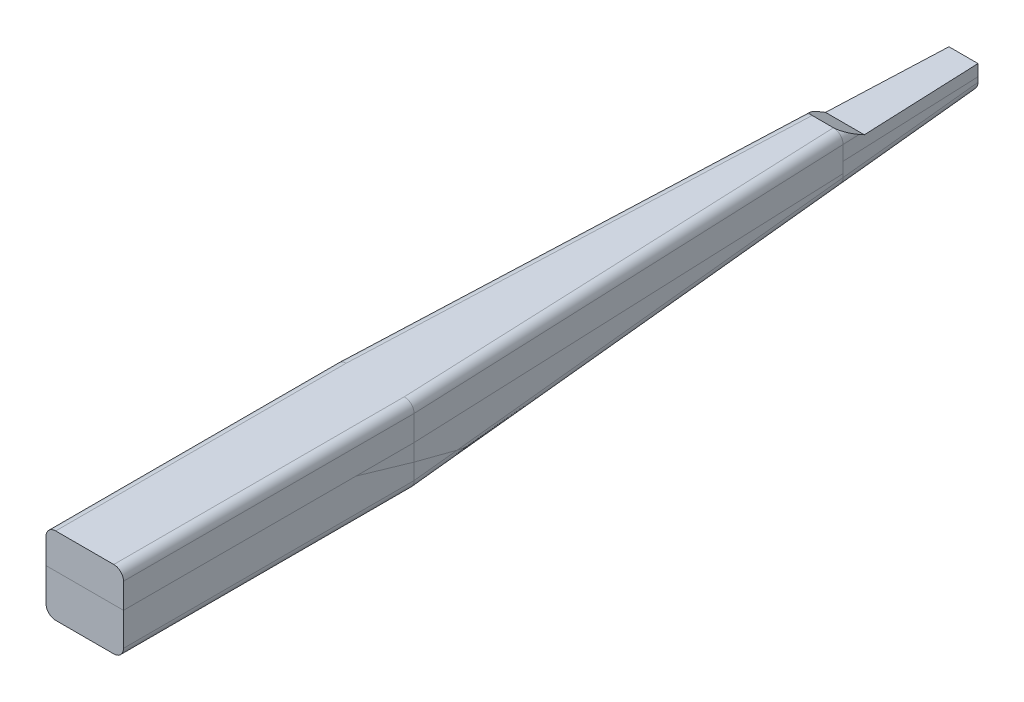
from build123d import *

# Parameters (mm, degrees)
SKETCH1_W              = 101.6
SKETCH1_H              = 101.6
BOSS_EXTRUDE1_DEPTH    = 381.1016
FILLET1_R              = 12.7
CUT_EXTRUDE2_DEPTH     = 177.8508
SPLIT1_SURFACE_1_BACK  = 1162.17
SPLIT1_SURFACE_1_DEPTH = 2324.34
SPLIT1_SURFACE_2_BACK  = 1162.17
SPLIT1_SURFACE_2_DEPTH = 2324.34


with BuildPart() as part:
    # Sketch1 → Boss-Extrude1 (new body)
    with BuildSketch(Plane.XY):
        Rectangle(SKETCH1_W, SKETCH1_H)
    extrude(amount=-BOSS_EXTRUDE1_DEPTH)

    # Sketch2 → section 0 of loft1
    with BuildSketch(Plane(origin=(0, 0, -1152.2456), x_dir=(-1, 0, 0), z_dir=(0, 0, -1)), mode=Mode.PRIVATE) as loft1_s0:
        with BuildLine():
            Line((-19.05, 50.8), (19.05, 50.8))
            Line((19.05, 50.8), (19.05, 0))
            Line((19.05, 0), (-19.05, 0))
            Line((-19.05, 0), (-19.05, 50.8))
        make_face()
    # loft up to a face of the part (loft1)
    loft([loft1_s0.sketch, part.faces().sort_by_distance((0, 0, -381.1016))[0]])

    # Fillet1
    # the kernel refuses this fillet: 12.7 mm, written as the material it takes off along each edge
    with BuildSketch(Plane(origin=(-50.8, -50.8, 31.75), x_dir=(1, 0, 0), z_dir=(0, 0, -1)), Plane(origin=(-50.8, 50.8, 31.75), x_dir=(0, -1, 0), z_dir=(0, 0, -1))) as fillet1_piece_1:
        with BuildLine():
            CenterArc((FILLET1_R, -FILLET1_R), FILLET1_R, 90, 90)
            Line((0, -FILLET1_R), (0, 0))
            Line((0, 0), (FILLET1_R, 0))
        make_face()
    extrude(amount=444.6016, mode=Mode.SUBTRACT)
    with BuildSketch(Plane(origin=(50.8, 50.8, 31.75), x_dir=(0, -1, 0), z_dir=(0, 0, -1)), Plane(origin=(50.8, -50.8, 31.75), x_dir=(-1, 0, 0), z_dir=(0, 0, -1))) as fillet1_piece_2:
        with BuildLine():
            CenterArc((FILLET1_R, FILLET1_R), FILLET1_R, 180, 90)
            Line((0, FILLET1_R), (0, 0))
            Line((0, 0), (FILLET1_R, 0))
        make_face()
    extrude(amount=444.6016, mode=Mode.SUBTRACT)
    with BuildSketch(Plane(origin=(17.750216352, 2.079653836, -1183.814745237), x_dir=(-0.999157137883709, -0.002698296397467829, 0.0409601393135606), z_dir=(0.04104891979132801, -0.06567827166612486, 0.9969961638917754))) as fillet1_piece_3:
        with BuildLine():
            CenterArc((FILLET1_R * 0.997299511279, -FILLET1_R), FILLET1_R, 90, 89.845064287)
            Line((-FILLET1_R * 0.00269683254081, -FILLET1_R * 0.997295864973), (0, 0))
            Line((0, 0), (FILLET1_R * 0.997299511279, 0))
        make_face()
    extrude(amount=836.795888178, mode=Mode.SUBTRACT)
    with BuildSketch(Plane(origin=(-17.750216352, 2.079653836, -1183.814745237), x_dir=(0.999157137883709, -0.0026982963974682855, 0.040960139313560615), z_dir=(-0.041048919791328055, -0.06567827166612487, 0.9969961638917754))) as fillet1_piece_4:
        with BuildLine():
            CenterArc((FILLET1_R * 0.997299511279, FILLET1_R), FILLET1_R, 180.154935713, 89.845064287)
            Line((-FILLET1_R * 0.00269683254081, FILLET1_R * 0.997295864973), (0, 0))
            Line((0, 0), (FILLET1_R * 0.997299511279, 0))
        make_face()
    extrude(amount=836.795888178, mode=Mode.SUBTRACT)
    with BuildSketch(Plane(origin=(-17.743876682, 50.8, -1183.968723142), x_dir=(0.9991534847855587, 0, 0.041137742291895554), z_dir=(-0.041137742291895554, 0, 0.9991534847855587))) as fillet1_piece_5:
        with BuildLine():
            CenterArc((FILLET1_R, -FILLET1_R), FILLET1_R, 90, 90)
            Line((0, -FILLET1_R), (0, 0))
            Line((0, 0), (FILLET1_R, 0))
        make_face()
    extrude(amount=835.297338189, mode=Mode.SUBTRACT)
    with BuildSketch(Plane(origin=(17.743876682, 50.8, -1183.968723142), x_dir=(-0.9991534847855587, 0, 0.041137742291895485), z_dir=(0.04113774229189549, 0, 0.9991534847855587))) as fillet1_piece_6:
        with BuildLine():
            CenterArc((FILLET1_R, FILLET1_R), FILLET1_R, 180, 90)
            Line((0, FILLET1_R), (0, 0))
            Line((0, 0), (FILLET1_R, 0))
        make_face()
    extrude(amount=835.297338189, mode=Mode.SUBTRACT)

    # Sketch4 → Cut-Extrude2 (cut, symmetric)
    with BuildSketch(Plane(origin=(0, 0, 0), x_dir=(0, 0, -1), z_dir=(1, 0, 0))):
        Polygon((1152.2456, 50.8), (1152.2456, 34.036), (996.7976, 34.036), (967.761500262, 50.8), align=None)
    extrude(amount=CUT_EXTRUDE2_DEPTH, both=True, mode=Mode.SUBTRACT)


with BuildPart() as body_2:
    # Split1: the piece behind the surface
    add(part.part)
    # Split1 surface: a surface, the sketch's curves swept straight by 2324.34 mm
    with BuildLine(Plane(origin=(50.8, 0, 0), x_dir=(0, 0, -1), z_dir=(1, 0, 0)).offset(-SPLIT1_SURFACE_1_BACK), mode=Mode.PRIVATE) as split1_surface_1_path:
        Line((0, -50.8), (0, 5.08))
        Line((0, 5.08), (304.8, 5.08))
        Line((304.8, 5.08), (475.411000163, -44.587259541))
        Line((475.411000163, -44.587259541), (381.1016, -50.8))
        Line((381.1016, -50.8), (0, -50.8))
    split1_surface_1 = Shell.extrude(split1_surface_1_path.wire(), (1 * SPLIT1_SURFACE_1_DEPTH, 0 * SPLIT1_SURFACE_1_DEPTH, 0 * SPLIT1_SURFACE_1_DEPTH))
    split(bisect_by=split1_surface_1, keep=Keep.BOTTOM)


with BuildPart() as part_1:
    add(part.part)

    # Split1: split by a surface, the side it looks to stays
    # Split1 surface: a surface, the sketch's curves swept straight by 2324.34 mm
    with BuildLine(Plane(origin=(50.8, 0, 0), x_dir=(0, 0, -1), z_dir=(1, 0, 0)).offset(-SPLIT1_SURFACE_2_BACK), mode=Mode.PRIVATE) as split1_surface_2_path:
        Line((0, -50.8), (0, 5.08))
        Line((0, 5.08), (304.8, 5.08))
        Line((304.8, 5.08), (475.411000163, -44.587259541))
        Line((475.411000163, -44.587259541), (381.1016, -50.8))
        Line((381.1016, -50.8), (0, -50.8))
    split1_surface_2 = Shell.extrude(split1_surface_2_path.wire(), (1 * SPLIT1_SURFACE_2_DEPTH, 0 * SPLIT1_SURFACE_2_DEPTH, 0 * SPLIT1_SURFACE_2_DEPTH))
    split(bisect_by=split1_surface_2, keep=Keep.TOP)


with BuildPart() as body_3:
    # Split3: the piece on the far side of the plane
    add(part_1.part)
    split(bisect_by=Plane.XY.offset(-967.761500262), keep=Keep.BOTTOM)


with BuildPart() as part_2:
    add(part_1.part)

    # Split3
    split(bisect_by=Plane.XY.offset(-967.761500262), keep=Keep.TOP)


with BuildPart() as body_4:
    # Split2: the piece on the far side of the plane
    add(part_2.part)
    split(bisect_by=Plane.ZX.offset(5.08), keep=Keep.BOTTOM)


with BuildPart() as part_3:
    add(part_2.part)

    # Split2
    split(bisect_by=Plane.ZX.offset(5.08), keep=Keep.TOP)


with BuildPart() as body_5:
    # Split4: the piece on the far side of the plane
    add(body_3.part)
    split(bisect_by=Plane.ZX.offset(19.05), keep=Keep.BOTTOM)


with BuildPart() as body_3_1:
    add(body_3.part)

    # Split4
    split(bisect_by=Plane.ZX.offset(19.05), keep=Keep.TOP)


solid = Compound([body_2.part, body_4.part, part_3.part, body_5.part, body_3_1.part])
